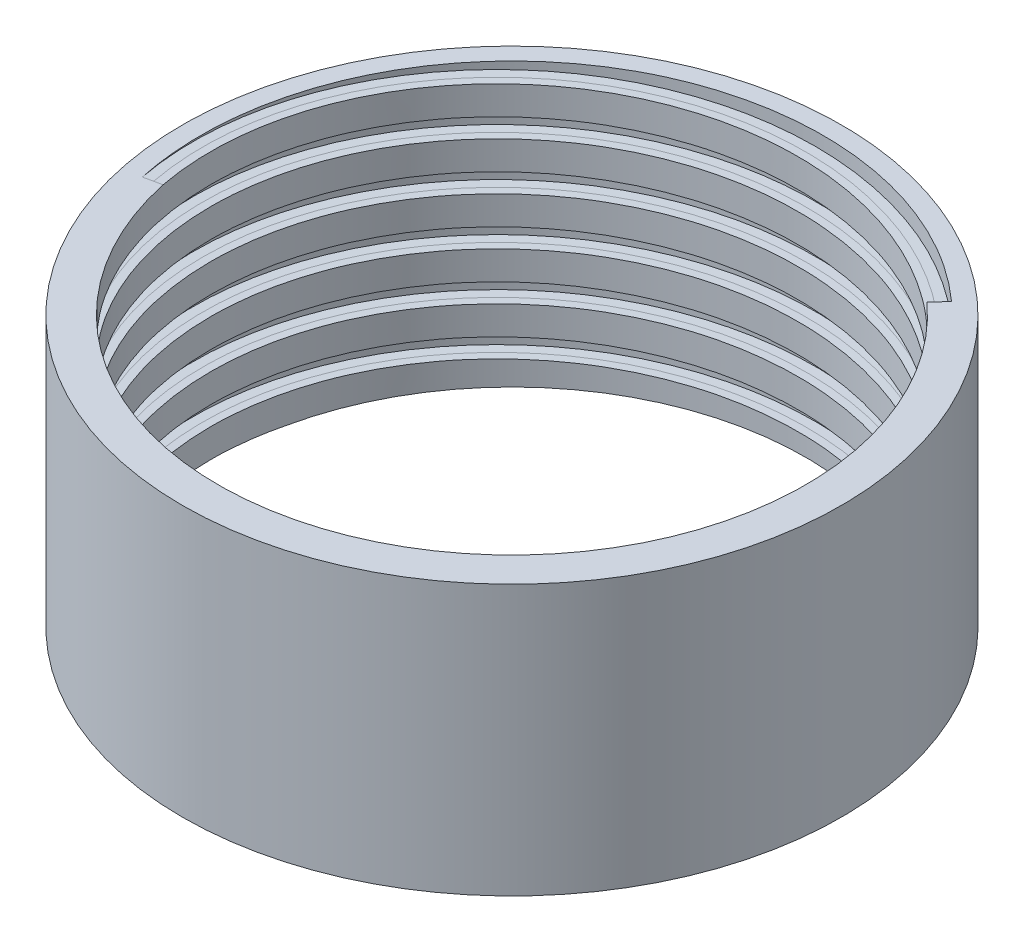
from build123d import *

# Parameters (mm, degrees)
SKETCH1_R           = 20.75
SKETCH1_R_2         = 18.5
BOSS_EXTRUDE1_DEPTH = 17
CUT_SWEEP1_PITCH    = 3


with BuildPart() as part:
    # Sketch1 → Boss-Extrude1 (new body)
    with BuildSketch(Plane(origin=(0, 0, 0), x_dir=(1, 0, 0), z_dir=(0, 1, 0))):
        with Locations(Location((0, 0, 0), (0, 0, 270))):
            Circle(SKETCH1_R)
        with Locations(Location((0, 0, 0), (0, 0, 270))):
            Circle(SKETCH1_R_2, mode=Mode.SUBTRACT)
    extrude(amount=BOSS_EXTRUDE1_DEPTH)

    # Cut-Sweep1: the profile of Sketch5 screwed along a right-hand helix of 8 turns, 10 arcs to a turn; built about Z, then put on its axis
    cut_sweep1_z = Axis((0, 0, 0), (0, 0, 1))
    cut_sweep1_corners = [(19, 0, -0.6), (17, 0, -0.6), (17, 0, 0.6), (19, 0, 0.6), (19.6, 0, 0.6), (19.6, 0, -0.6)]
    with BuildLine(mode=Mode.PRIVATE) as cut_sweep1_profile:
        Line(cut_sweep1_corners[0], cut_sweep1_corners[1])
        Line(cut_sweep1_corners[1], cut_sweep1_corners[2])
        Line(cut_sweep1_corners[2], cut_sweep1_corners[3])
        Line(cut_sweep1_corners[3], cut_sweep1_corners[4])
        Line(cut_sweep1_corners[4], cut_sweep1_corners[5])
        Line(cut_sweep1_corners[5], cut_sweep1_corners[0])
    cut_sweep1_cap = Face(cut_sweep1_profile.wire())
    cut_sweep1_turn_angles = [0, 18, 36, 54, 72, 90, 108, 126, 144, 162, 180, 198, 216, 234, 252, 270, 288, 306, 324, 342, 360]
    cut_sweep1_turn_weights = [1, 0.9510565162951535, 1, 0.9510565162951535, 1, 0.9510565162951535, 1, 0.9510565162951535, 1, 0.9510565162951535, 1, 0.9510565162951535, 1, 0.9510565162951535, 1, 0.9510565162951535, 1, 0.9510565162951535, 1, 0.9510565162951535, 1]
    cut_sweep1_turn_rails = [Edge.make_bspline([Vector(p[0], p[1], 0).rotate(cut_sweep1_z, cut_sweep1_turn_angles[k]) / cut_sweep1_turn_weights[k] + Vector(0, 0, p[2] + CUT_SWEEP1_PITCH * cut_sweep1_turn_angles[k] / 360) for k in range(21)], [0, 0, 0, 1, 1, 2, 2, 3, 3, 4, 4, 5, 5, 6, 6, 7, 7, 8, 8, 9, 9, 10, 10, 10], 2, cut_sweep1_turn_weights) for p in cut_sweep1_corners]
    cut_sweep1_turn_sides = [Face.make_surface_from_curves(cut_sweep1_turn_rails[p[0]], cut_sweep1_turn_rails[p[1]]) for p in [(0, 1), (1, 2), (2, 3), (3, 4), (4, 5), (5, 0)]]
    cut_sweep1 = Plane(origin=(0, 22, 0), x_dir=(1, 0, 0), z_dir=(0, -1, 0)) * Solid(Shell([*[p.moved(Location((0, 0, CUT_SWEEP1_PITCH * i))) for i in range(8) for p in cut_sweep1_turn_sides], cut_sweep1_cap, cut_sweep1_cap.rotate(cut_sweep1_z, 2880).moved(Location((0, 0, CUT_SWEEP1_PITCH * 2880 / 360)))]))
    add(cut_sweep1, mode=Mode.SUBTRACT)


solid = part.part
